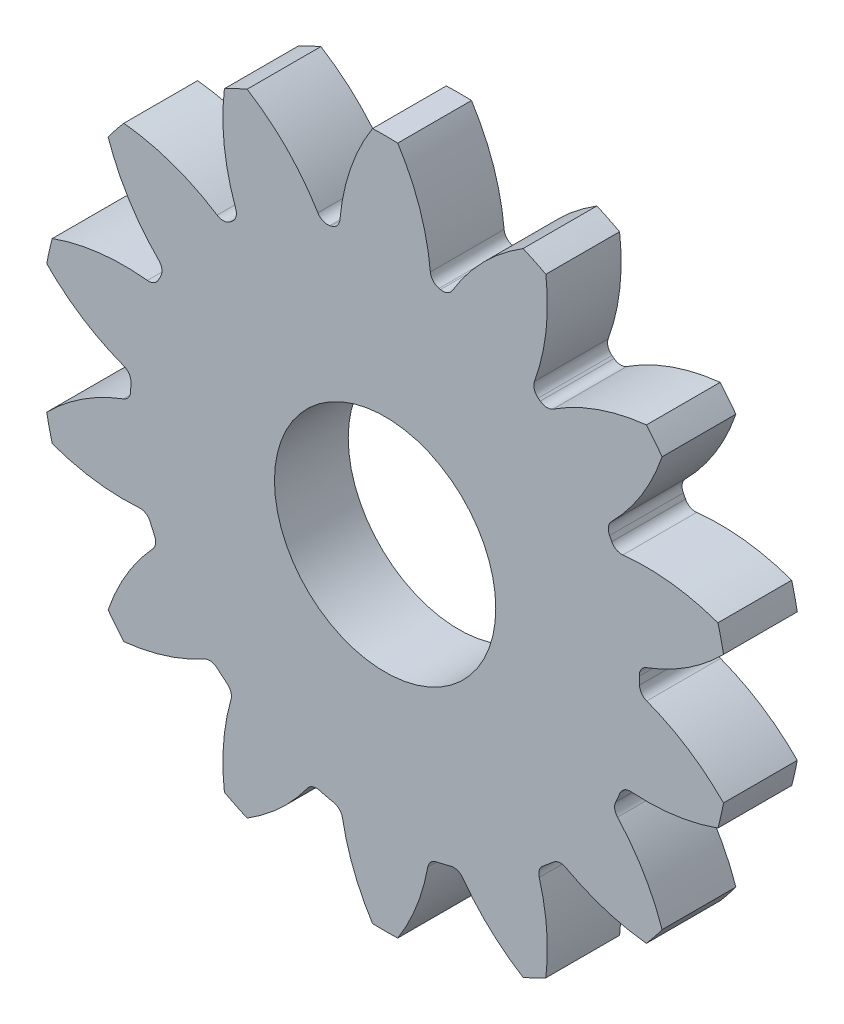
from build123d import *

# Parameters (mm, degrees)
SKETCH_1_R               = 17.25
EXTRUDE_1_DEPTH          = 5
EXTRUDE_2_DEPTH          = 5
FILLET_1_R               = 0.75
PATTERN_CIRCULAR_1_DEPTH = 5
CUT_EXTRUDE_2_REACH      = 35.573
SKETCH_2_R               = 7.5


# Read off the part's stored shape, not the designer's step: 원형 패턴1
with BuildPart() as part:
    # 스케치1 → 보스-돌출1 (new body)
    with BuildSketch(Plane.XY):
        Circle(SKETCH_1_R)
    extrude(amount=EXTRUDE_1_DEPTH)

    # 스케치1<3> → 보스-돌출2 (add)
    with BuildSketch(Plane.XY):
        with BuildLine():
            ThreePointArc((3.105, 16.968249026), (2.435929865, 20.62271117), (0.855, 23.984765477))
            ThreePointArc((0.855, 23.984765477), (0, 24), (-0.855, 23.984765477))
            ThreePointArc((-0.855, 23.984765477), (-2.435929865, 20.62271117), (-3.105, 16.968249026))
            ThreePointArc((-3.105, 16.968249026), (0, 17.25), (3.105, 16.968249026))
        make_face()
    extrude(amount=EXTRUDE_2_DEPTH)

    # 필렛1
    fillet_1_edges = [part.edges().sort_by_distance(p)[0] for p in [
        (-3.105, 16.968249026, 2.5),
        (3.105, 16.968249026, 2.5),
    ]]
    fillet(fillet_1_edges, radius=FILLET_1_R)

    # 원형 패턴1 outline → 원형 패턴1 (add)
    with BuildSketch(Plane.XY):
        with BuildLine():
            ThreePointArc((3.752409392, 16.836921446), (7.228370534, 15.662476159), (10.37732262, 13.77946571))
            ThreePointArc((10.37732262, 13.77946571), (10.109330299, 14.165782518), (10.123973341, 14.635725219))
            ThreePointArc((10.123973341, 14.635725219), (10.902507886, 17.923971687), (10.894078225, 21.303115042))
            ThreePointArc((10.894078225, 21.303115042), (10.130359855, 21.68781147), (9.353421461, 22.045056236))
            ThreePointArc((9.353421461, 22.045056236), (6.66426095, 19.902390957), (4.559090047, 17.183778404))
            ThreePointArc((4.559090047, 17.183778404), (4.211817106, 16.879954744), (3.752409392, 16.836921446))
        make_face()
        with BuildLine():
            ThreePointArc((10.519299619, 13.671387476), (13.161797978, 11.150317215), (15.214303094, 8.129420728))
            ThreePointArc((15.214303094, 8.129420728), (15.133819906, 8.592297997), (15.344497995, 9.012235673))
            ThreePointArc((15.344497995, 9.012235673), (17.375059394, 11.575860868), (18.775450651, 14.531238688))
            ThreePointArc((18.775450651, 14.531238688), (18.2542777, 15.209203175), (17.70928309, 15.868170523))
            ThreePointArc((17.70928309, 15.868170523), (14.414969994, 15.125158945), (11.38395589, 13.636025477))
            ThreePointArc((11.38395589, 13.636025477), (10.94601321, 13.516422059), (10.519299619, 13.671387476))
        make_face()
        with BuildLine():
            ThreePointArc((15.364476978, 7.841896914), (16.663551392, 4.459658622), (17.227504247, 0.880680084))
            ThreePointArc((17.227504247, 0.880680084), (17.349588602, 1.330612703), (17.713914892, 1.62149121))
            ThreePointArc((17.713914892, 1.62149121), (20.511209748, 3.030450816), (22.938114809, 5.010389578))
            ThreePointArc((22.938114809, 5.010389578), (22.762711972, 5.847342943), (22.557604012, 6.677516308))
            ThreePointArc((22.557604012, 6.677516308), (19.379376386, 7.424645609), (16.1145377, 7.437349496))
            ThreePointArc((16.1145377, 7.437349496), (15.676466798, 7.522741397), (15.364476978, 7.841896914))
        make_face()
        with BuildLine():
            ThreePointArc((17.246205523, 0.361794236), (16.948744989, -3.209757512), (15.919681663, -6.642758143))
            ThreePointArc((15.919681663, -6.642758143), (16.218467781, -6.293015235), (16.665227716, -6.183476169))
            ThreePointArc((16.665227716, -6.183476169), (19.653637621, -6.085826774), (22.557604012, -5.373711355))
            ThreePointArc((22.557604012, -5.373711355), (22.762711972, -4.543537991), (22.938114809, -3.706584626))
            ThreePointArc((22.938114809, -3.706584626), (20.519516774, -1.732038623), (17.732464097, -0.324634719))
            ThreePointArc((17.732464097, -0.324634719), (17.384038193, -0.056011184), (17.246205523, 0.361794236))
        make_face()
        with BuildLine():
            ThreePointArc((15.624899975, -7.30924078), (13.802641251, -10.346477396), (11.398453982, -12.947499636))
            ThreePointArc((11.398453982, -12.947499636), (11.812346904, -12.764896736), (12.255961374, -12.853538558))
            ThreePointArc((12.255961374, -12.853538558), (14.896975546, -13.981953909), (17.70928309, -14.56436557))
            ThreePointArc((17.70928309, -14.56436557), (18.2542777, -13.905398222), (18.775450651, -13.227433735))
            ThreePointArc((18.775450651, -13.227433735), (17.528042353, -10.523846266), (15.751756091, -8.13423965))
            ThreePointArc((15.751756091, -8.13423965), (15.562955662, -7.741018123), (15.624899975, -7.30924078))
        make_face()
        with BuildLine():
            ThreePointArc((10.701599161, -13.529163884), (7.742304938, -15.414902343), (4.462626447, -16.662756831))
            ThreePointArc((4.462626447, -16.662756831), (4.907143939, -16.680291261), (5.263531943, -16.946544614))
            ThreePointArc((5.263531943, -16.946544614), (7.123124119, -19.043668749), (9.353421461, -20.741251283))
            ThreePointArc((9.353421461, -20.741251283), (10.130359855, -20.384006517), (10.894078225, -19.99931009))
            ThreePointArc((10.894078225, -19.99931009), (10.952928458, -17.13877644), (10.445613014, -14.322973331))
            ThreePointArc((10.445613014, -14.322973331), (10.45308323, -13.887202628), (10.701599161, -13.529163884))
        make_face()
        with BuildLine():
            ThreePointArc((3.478512175, -16.895634142), (0, -17.25), (-3.478512175, -16.895634142))
            ThreePointArc((-3.478512175, -16.895634142), (-3.093309657, -17.106080205), (-2.891850292, -17.496057961))
            ThreePointArc((-2.891850292, -17.496057961), (-2.126287606, -20.187844374), (-0.855, -22.680960525))
            ThreePointArc((-0.855, -22.680960525), (0, -22.696195047), (0.855, -22.680960525))
            ThreePointArc((0.855, -22.680960525), (2.126287606, -20.187844374), (2.891850292, -17.496057961))
            ThreePointArc((2.891850292, -17.496057961), (3.093309657, -17.106080205), (3.478512175, -16.895634142))
        make_face()
        with BuildLine():
            ThreePointArc((-4.462626447, -16.662756831), (-7.742304938, -15.414902343), (-10.701599161, -13.529163884))
            ThreePointArc((-10.701599161, -13.529163884), (-10.45308323, -13.887202628), (-10.445613014, -14.322973331))
            ThreePointArc((-10.445613014, -14.322973331), (-10.952928458, -17.13877644), (-10.894078225, -19.99931009))
            ThreePointArc((-10.894078225, -19.99931009), (-10.130359855, -20.384006517), (-9.353421461, -20.741251283))
            ThreePointArc((-9.353421461, -20.741251283), (-7.123124119, -19.043668749), (-5.263531943, -16.946544614))
            ThreePointArc((-5.263531943, -16.946544614), (-4.907143939, -16.680291261), (-4.462626447, -16.662756831))
        make_face()
        with BuildLine():
            ThreePointArc((-11.398453982, -12.947499636), (-13.802641251, -10.346477396), (-15.624899975, -7.30924078))
            ThreePointArc((-15.624899975, -7.30924078), (-15.562955662, -7.741018123), (-15.751756091, -8.13423965))
            ThreePointArc((-15.751756091, -8.13423965), (-17.528042353, -10.523846266), (-18.775450651, -13.227433735))
            ThreePointArc((-18.775450651, -13.227433735), (-18.2542777, -13.905398222), (-17.70928309, -14.56436557))
            ThreePointArc((-17.70928309, -14.56436557), (-14.896975546, -13.981953909), (-12.255961374, -12.853538558))
            ThreePointArc((-12.255961374, -12.853538558), (-11.812346904, -12.764896736), (-11.398453982, -12.947499636))
        make_face()
        with BuildLine():
            ThreePointArc((-15.919681663, -6.642758143), (-16.948744989, -3.209757512), (-17.246205523, 0.361794236))
            ThreePointArc((-17.246205523, 0.361794236), (-17.384038193, -0.056011184), (-17.732464097, -0.324634719))
            ThreePointArc((-17.732464097, -0.324634719), (-20.519516774, -1.732038623), (-22.938114809, -3.706584626))
            ThreePointArc((-22.938114809, -3.706584626), (-22.762711972, -4.543537991), (-22.557604012, -5.373711355))
            ThreePointArc((-22.557604012, -5.373711355), (-19.653637621, -6.085826774), (-16.665227716, -6.183476169))
            ThreePointArc((-16.665227716, -6.183476169), (-16.218467781, -6.293015235), (-15.919681663, -6.642758143))
        make_face()
        with BuildLine():
            ThreePointArc((-17.227504247, 0.880680084), (-16.663551392, 4.459658622), (-15.364476978, 7.841896914))
            ThreePointArc((-15.364476978, 7.841896914), (-15.676466798, 7.522741397), (-16.1145377, 7.437349496))
            ThreePointArc((-16.1145377, 7.437349496), (-19.379376386, 7.424645609), (-22.557604012, 6.677516308))
            ThreePointArc((-22.557604012, 6.677516308), (-22.762711972, 5.847342943), (-22.938114809, 5.010389578))
            ThreePointArc((-22.938114809, 5.010389578), (-20.511209748, 3.030450816), (-17.713914892, 1.62149121))
            ThreePointArc((-17.713914892, 1.62149121), (-17.349588602, 1.330612703), (-17.227504247, 0.880680084))
        make_face()
        with BuildLine():
            ThreePointArc((-15.214303094, 8.129420728), (-13.161797978, 11.150317215), (-10.519299619, 13.671387476))
            ThreePointArc((-10.519299619, 13.671387476), (-10.94601321, 13.516422059), (-11.38395589, 13.636025477))
            ThreePointArc((-11.38395589, 13.636025477), (-14.414969994, 15.125158945), (-17.70928309, 15.868170523))
            ThreePointArc((-17.70928309, 15.868170523), (-18.2542777, 15.209203175), (-18.775450651, 14.531238688))
            ThreePointArc((-18.775450651, 14.531238688), (-17.375059394, 11.575860868), (-15.344497995, 9.012235673))
            ThreePointArc((-15.344497995, 9.012235673), (-15.133819906, 8.592297997), (-15.214303094, 8.129420728))
        make_face()
        with BuildLine():
            ThreePointArc((-4.559090047, 17.183778404), (-6.66426095, 19.902390957), (-9.353421461, 22.045056236))
            ThreePointArc((-9.353421461, 22.045056236), (-10.130359855, 21.68781147), (-10.894078225, 21.303115042))
            ThreePointArc((-10.894078225, 21.303115042), (-10.902507886, 17.923971687), (-10.123973341, 14.635725219))
            ThreePointArc((-10.123973341, 14.635725219), (-10.109330299, 14.165782518), (-10.37732262, 13.77946571))
            ThreePointArc((-10.37732262, 13.77946571), (-7.228370534, 15.662476159), (-3.752409392, 16.836921446))
            ThreePointArc((-3.752409392, 16.836921446), (-4.211817106, 16.879954744), (-4.559090047, 17.183778404))
        make_face()
    extrude(amount=PATTERN_CIRCULAR_1_DEPTH)

    # 스케치2 → 컷-돌출2 (cut, up to next)
    with BuildSketch(Plane.XY.offset(5), mode=Mode.PRIVATE) as cut_extrude_2_sk1:
        Circle(SKETCH_2_R)
    cut_extrude_2_tool1 = extrude(cut_extrude_2_sk1.sketch, amount=-CUT_EXTRUDE_2_REACH, mode=Mode.PRIVATE) & part.part
    add(cut_extrude_2_tool1.solids().sort_by_distance((0, 0, 5))[0], mode=Mode.SUBTRACT)


solid = part.part
